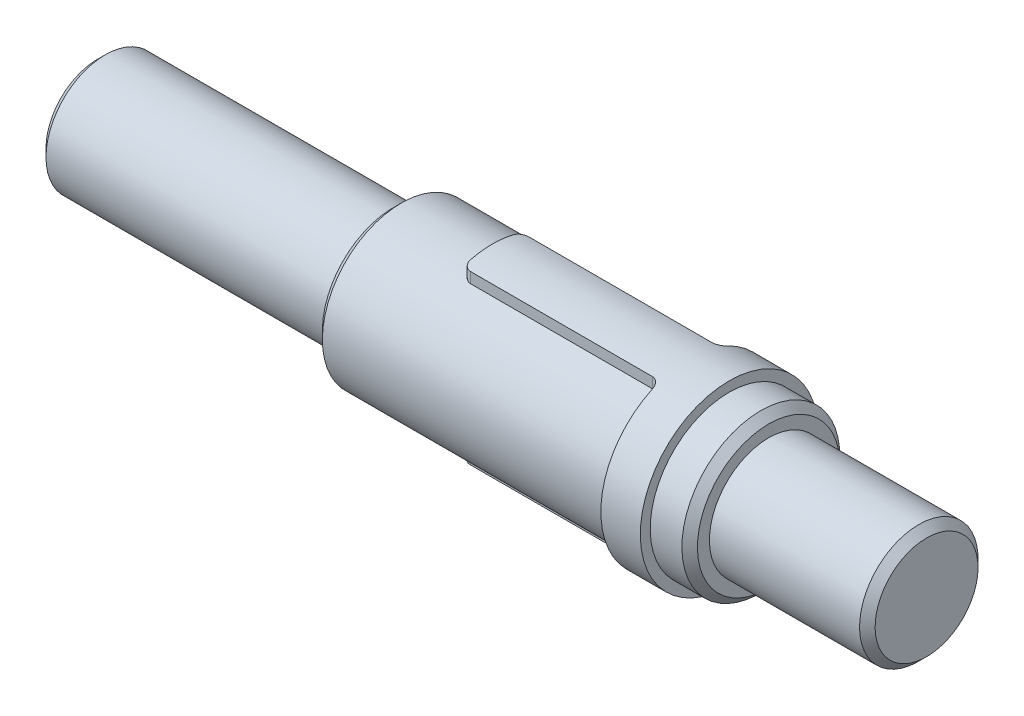
from build123d import *
from build123d.topology import SkipClean

# Parameters (mm, degrees)
CUT_EXTRUDE1_START = -254
CUT_EXTRUDE1_DEPTH = 254
CHAMFER1_SIZE      = 10
CHAMFER2_SIZE      = 10
CHAMFER3_SIZE      = 10
CHAMFER4_SIZE      = 10
FILLET1_R          = 10


with BuildPart() as part:
    # Sketch1 → Revolve4 (revolve)
    with BuildSketch(Plane.XY):
        Polygon((-381, 4.199357945), (-381, 80.399357945), (0, 80.399357945), (0, 105.799357945), (127, 105.799357945), (127, 118.499357945), (431.8, 118.499357945), (431.8, 105.799357945), (482.6, 105.799357945), (482.6, 80.399357945), (685.8, 80.399357945), (685.8, 4.199357945), align=None)
    revolve(axis=Axis((685.8, 4.199357945, 0), (-1, 0, 0)))

    # Sketch3 → Cut-Extrude1 (cut)
    with SkipClean():  # the faces are left unmerged after this step: merging them gives an invalid solid
        with BuildSketch(Plane.ZY.offset(-127).offset(CUT_EXTRUDE1_START)):
            with BuildLine():
                Line((38.1, -89.986362841), (38.1, -103.563715507))
                ThreePointArc((38.1, -103.563715507), (93.3255592, -61.791777823), (114.3, 4.199357945))
                ThreePointArc((114.3, 4.199357945), (93.3255592, 70.190493714), (38.1, 111.962431398))
                Line((38.1, 111.962431398), (38.1, 98.385078732))
                ThreePointArc((38.1, 98.385078732), (84.242269675, 60.995484574), (101.6, 4.199357945))
                ThreePointArc((101.6, 4.199357945), (84.242269675, -52.596768683), (38.1, -89.986362841))
            make_face()
            with BuildLine():
                ThreePointArc((-38.1, 111.962431398), (-114.3, 4.199357945), (-38.1, -103.563715507))
                Line((-38.1, -103.563715507), (-38.1, -89.986362841))
                ThreePointArc((-38.1, -89.986362841), (-101.6, 4.199357945), (-38.1, 98.385078732))
                Line((-38.1, 98.385078732), (-38.1, 111.962431398))
            make_face()
        extrude(amount=CUT_EXTRUDE1_DEPTH, mode=Mode.SUBTRACT)

    # Chamfer1
    chamfer1_edges = [part.edges().sort_by_distance(p)[0] for p in [
        (685.8, -72.000642055, 0),
    ]]
    chamfer(chamfer1_edges, length=CHAMFER1_SIZE)

    # Chamfer2
    chamfer2_edges = [part.edges().sort_by_distance(p)[0] for p in [
        (482.6, -97.400642055, 0),
    ]]
    chamfer(chamfer2_edges, length=CHAMFER2_SIZE)

    # Chamfer3
    chamfer3_edges = [part.edges().sort_by_distance(p)[0] for p in [
        (-381, -72.000642055, 0),
    ]]
    chamfer(chamfer3_edges, length=CHAMFER3_SIZE)

    # Chamfer4
    chamfer4_edges = [part.edges().sort_by_distance(p)[0] for p in [
        (0, -97.400642055, 0),
    ]]
    chamfer(chamfer4_edges, length=CHAMFER4_SIZE)

    # Fillet1
    # the kernel refuses this fillet: 10 mm, written as the material it adds along each edge
    with BuildSketch(Plane(origin=(381, -64.986362841, 38.1), x_dir=(-1, 0, 0), z_dir=(0, -1, 0))) as fillet1_piece_1_section:
        with BuildLine():
            CenterArc((FILLET1_R, -FILLET1_R), FILLET1_R, 90, 90)
            Line((0, -FILLET1_R), (-FILLET1_R * 0.02, -FILLET1_R))
            Line((-FILLET1_R * 0.02, -FILLET1_R), (-FILLET1_R * 0.02, FILLET1_R * 0.02))
            Line((-FILLET1_R * 0.02, FILLET1_R * 0.02), (FILLET1_R, FILLET1_R * 0.02))
            Line((FILLET1_R, FILLET1_R * 0.02), (FILLET1_R, 0))
        make_face()
    fillet1_piece_1 = extrude(amount=63.577352667, mode=Mode.PRIVATE)
    fillet1_piece_1 = fillet1_piece_1 - Plane(origin=(378.747471164, 4.199357945, 0), x_dir=(0, 0.9270248108869475, 0.3750000000000256), z_dir=(1, 0, 0)) * Cylinder(101.6, 168, mode=Mode.PRIVATE)
    fillet1_piece_1 = fillet1_piece_1 & Plane(origin=(378.747471164, 4.199357945, 0), x_dir=(0, 1, 0), z_dir=(1, 0, 0)) * Cylinder(114.3, 168, mode=Mode.PRIVATE)
    add(fillet1_piece_1)
    with BuildSketch(Plane(origin=(381, 136.962431398, 38.1), x_dir=(-1, 0, 0), z_dir=(0, -1, 0))) as fillet1_piece_2_section:
        with BuildLine():
            CenterArc((FILLET1_R, -FILLET1_R), FILLET1_R, 90, 90)
            Line((0, -FILLET1_R), (-FILLET1_R * 0.02, -FILLET1_R))
            Line((-FILLET1_R * 0.02, -FILLET1_R), (-FILLET1_R * 0.02, FILLET1_R * 0.02))
            Line((-FILLET1_R * 0.02, FILLET1_R * 0.02), (FILLET1_R, FILLET1_R * 0.02))
            Line((FILLET1_R, FILLET1_R * 0.02), (FILLET1_R, 0))
        make_face()
    fillet1_piece_2 = extrude(amount=63.577352667, mode=Mode.PRIVATE)
    fillet1_piece_2 = fillet1_piece_2 - Plane(origin=(378.747465839, 4.199357945, 0), x_dir=(0, 0.9270248108869475, 0.3750000000000256), z_dir=(1, 0, 0)) * Cylinder(101.6, 168, mode=Mode.PRIVATE)
    fillet1_piece_2 = fillet1_piece_2 & Plane(origin=(378.747465839, 4.199357945, 0), x_dir=(0, 1, 0), z_dir=(1, 0, 0)) * Cylinder(114.3, 168, mode=Mode.PRIVATE)
    add(fillet1_piece_2)
    with BuildSketch(Plane(origin=(381, 73.385078732, -38.1), x_dir=(-1, 0, 0), z_dir=(0, 1, 0))) as fillet1_piece_3_section:
        with BuildLine():
            CenterArc((FILLET1_R, -FILLET1_R), FILLET1_R, 90, 90)
            Line((0, -FILLET1_R), (-FILLET1_R * 0.02, -FILLET1_R))
            Line((-FILLET1_R * 0.02, -FILLET1_R), (-FILLET1_R * 0.02, FILLET1_R * 0.02))
            Line((-FILLET1_R * 0.02, FILLET1_R * 0.02), (FILLET1_R, FILLET1_R * 0.02))
            Line((FILLET1_R, FILLET1_R * 0.02), (FILLET1_R, 0))
        make_face()
    fillet1_piece_3 = extrude(amount=63.577352667, mode=Mode.PRIVATE)
    fillet1_piece_3 = fillet1_piece_3 - Plane(origin=(378.747465659, 4.199357945, 0), x_dir=(0, -0.9270248108869582, -0.3749999999999992), z_dir=(1, 0, 0)) * Cylinder(101.6, 168, mode=Mode.PRIVATE)
    fillet1_piece_3 = fillet1_piece_3 & Plane(origin=(378.747465659, 4.199357945, 0), x_dir=(0, 1, 0), z_dir=(1, 0, 0)) * Cylinder(114.3, 168, mode=Mode.PRIVATE)
    add(fillet1_piece_3)
    with BuildSketch(Plane(origin=(381, -128.563715507, -38.1), x_dir=(-1, 0, 0), z_dir=(0, 1, 0))) as fillet1_piece_4_section:
        with BuildLine():
            CenterArc((FILLET1_R, -FILLET1_R), FILLET1_R, 90, 90)
            Line((0, -FILLET1_R), (-FILLET1_R * 0.02, -FILLET1_R))
            Line((-FILLET1_R * 0.02, -FILLET1_R), (-FILLET1_R * 0.02, FILLET1_R * 0.02))
            Line((-FILLET1_R * 0.02, FILLET1_R * 0.02), (FILLET1_R, FILLET1_R * 0.02))
            Line((FILLET1_R, FILLET1_R * 0.02), (FILLET1_R, 0))
        make_face()
    fillet1_piece_4 = extrude(amount=63.577352667, mode=Mode.PRIVATE)
    fillet1_piece_4 = fillet1_piece_4 - Plane(origin=(378.747464841, 4.199357945, 0), x_dir=(0, -0.9270248108869582, -0.3749999999999992), z_dir=(1, 0, 0)) * Cylinder(101.6, 168, mode=Mode.PRIVATE)
    fillet1_piece_4 = fillet1_piece_4 & Plane(origin=(378.747464841, 4.199357945, 0), x_dir=(0, 1, 0), z_dir=(1, 0, 0)) * Cylinder(114.3, 168, mode=Mode.PRIVATE)
    add(fillet1_piece_4)
    # the kernel refuses this fillet: 10 mm, written as the material it takes off along each edge
    with BuildSketch(Plane(origin=(127, -64.986362841, 38.1), x_dir=(0, 0, -1), z_dir=(0, -1, 0))) as fillet1_2_piece_1_section:
        with BuildLine():
            CenterArc((FILLET1_R, FILLET1_R), FILLET1_R, 180, 90)
            Line((0, FILLET1_R), (-FILLET1_R * 0.02, FILLET1_R))
            Line((-FILLET1_R * 0.02, FILLET1_R), (-FILLET1_R * 0.02, -FILLET1_R * 0.02))
            Line((-FILLET1_R * 0.02, -FILLET1_R * 0.02), (FILLET1_R, -FILLET1_R * 0.02))
            Line((FILLET1_R, -FILLET1_R * 0.02), (FILLET1_R, 0))
        make_face()
    fillet1_2_piece_1 = extrude(amount=63.577352667, mode=Mode.PRIVATE)
    fillet1_2_piece_1 = fillet1_2_piece_1 - Plane(origin=(129.273265728, 4.199357945, 0), x_dir=(0, 1, 0), z_dir=(1, 0, 0)) * Cylinder(101.6, 168, mode=Mode.PRIVATE)
    fillet1_2_piece_1 = fillet1_2_piece_1 & Plane(origin=(129.273265728, 4.199357945, 0), x_dir=(0, 1, 0), z_dir=(1, 0, 0)) * Cylinder(114.3, 168, mode=Mode.PRIVATE)
    add(fillet1_2_piece_1, mode=Mode.SUBTRACT)
    with BuildSketch(Plane(origin=(127, 136.962431398, 38.1), x_dir=(0, 0, -1), z_dir=(0, -1, 0))) as fillet1_2_piece_2_section:
        with BuildLine():
            CenterArc((FILLET1_R, FILLET1_R), FILLET1_R, 180, 90)
            Line((0, FILLET1_R), (-FILLET1_R * 0.02, FILLET1_R))
            Line((-FILLET1_R * 0.02, FILLET1_R), (-FILLET1_R * 0.02, -FILLET1_R * 0.02))
            Line((-FILLET1_R * 0.02, -FILLET1_R * 0.02), (FILLET1_R, -FILLET1_R * 0.02))
            Line((FILLET1_R, -FILLET1_R * 0.02), (FILLET1_R, 0))
        make_face()
    fillet1_2_piece_2 = extrude(amount=63.577352667, mode=Mode.PRIVATE)
    fillet1_2_piece_2 = fillet1_2_piece_2 - Plane(origin=(129.273255891, 4.199357945, 0), x_dir=(0, 1, 0), z_dir=(1, 0, 0)) * Cylinder(101.6, 168, mode=Mode.PRIVATE)
    fillet1_2_piece_2 = fillet1_2_piece_2 & Plane(origin=(129.273255891, 4.199357945, 0), x_dir=(0, 1, 0), z_dir=(1, 0, 0)) * Cylinder(114.3, 168, mode=Mode.PRIVATE)
    add(fillet1_2_piece_2, mode=Mode.SUBTRACT)
    with BuildSketch(Plane(origin=(127, -128.563715507, -38.1), x_dir=(0, 0, 1), z_dir=(0, 1, 0))) as fillet1_2_piece_3_section:
        with BuildLine():
            CenterArc((FILLET1_R, FILLET1_R), FILLET1_R, 180, 90)
            Line((0, FILLET1_R), (-FILLET1_R * 0.02, FILLET1_R))
            Line((-FILLET1_R * 0.02, FILLET1_R), (-FILLET1_R * 0.02, -FILLET1_R * 0.02))
            Line((-FILLET1_R * 0.02, -FILLET1_R * 0.02), (FILLET1_R, -FILLET1_R * 0.02))
            Line((FILLET1_R, -FILLET1_R * 0.02), (FILLET1_R, 0))
        make_face()
    fillet1_2_piece_3 = extrude(amount=63.577352667, mode=Mode.PRIVATE)
    fillet1_2_piece_3 = fillet1_2_piece_3 - Plane(origin=(129.273255891, 4.199357945, 0), x_dir=(0, 1, 0), z_dir=(1, 0, 0)) * Cylinder(101.6, 168, mode=Mode.PRIVATE)
    fillet1_2_piece_3 = fillet1_2_piece_3 & Plane(origin=(129.273255891, 4.199357945, 0), x_dir=(0, 1, 0), z_dir=(1, 0, 0)) * Cylinder(114.3, 168, mode=Mode.PRIVATE)
    add(fillet1_2_piece_3, mode=Mode.SUBTRACT)
    with BuildSketch(Plane(origin=(127, 73.385078732, -38.1), x_dir=(0, 0, 1), z_dir=(0, 1, 0))) as fillet1_2_piece_4_section:
        with BuildLine():
            CenterArc((FILLET1_R, FILLET1_R), FILLET1_R, 180, 90)
            Line((0, FILLET1_R), (-FILLET1_R * 0.02, FILLET1_R))
            Line((-FILLET1_R * 0.02, FILLET1_R), (-FILLET1_R * 0.02, -FILLET1_R * 0.02))
            Line((-FILLET1_R * 0.02, -FILLET1_R * 0.02), (FILLET1_R, -FILLET1_R * 0.02))
            Line((FILLET1_R, -FILLET1_R * 0.02), (FILLET1_R, 0))
        make_face()
    fillet1_2_piece_4 = extrude(amount=63.577352667, mode=Mode.PRIVATE)
    fillet1_2_piece_4 = fillet1_2_piece_4 - Plane(origin=(129.273265728, 4.199357945, 0), x_dir=(0, 1, 0), z_dir=(1, 0, 0)) * Cylinder(101.6, 168, mode=Mode.PRIVATE)
    fillet1_2_piece_4 = fillet1_2_piece_4 & Plane(origin=(129.273265728, 4.199357945, 0), x_dir=(0, 1, 0), z_dir=(1, 0, 0)) * Cylinder(114.3, 168, mode=Mode.PRIVATE)
    add(fillet1_2_piece_4, mode=Mode.SUBTRACT)


solid = part.part
